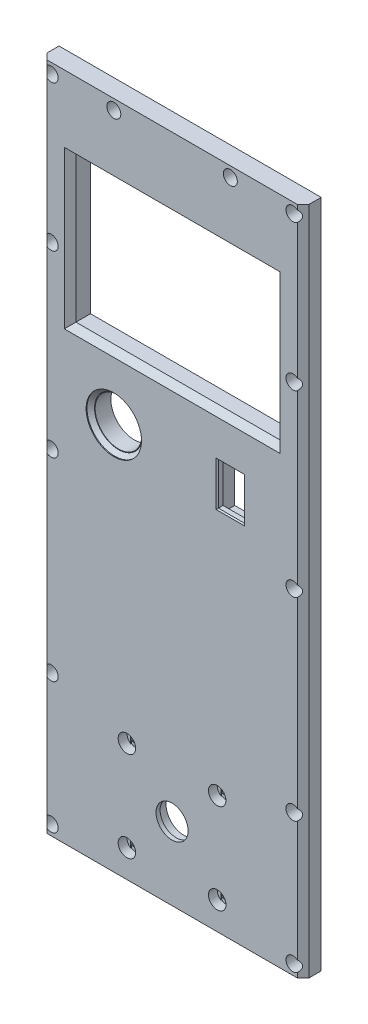
from build123d import *

# Parameters (mm, degrees)
SKETCH1_W           = 90
SKETCH1_H           = 230
SKETCH1_W_2         = 76
SKETCH1_H_2         = 216
BOSS_EXTRUDE1_DEPTH = 7
SKETCH2_W           = 76
SKETCH2_H           = 50
BOSS_EXTRUDE2_DEPTH = 7
SKETCH3_R           = 5.5
CUT_EXTRUDE1_DEPTH  = 124.689126442
SKETCH4_R           = 6.05
CUT_EXTRUDE2_DEPTH  = 5.6
SKETCH5_R           = 12
CUT_EXTRUDE3_DEPTH  = 3
SKETCH6_R           = 1.7
CUT_EXTRUDE4_DEPTH  = 124.689126442
SKETCH7_W           = 60
SKETCH7_H           = 45
CUT_EXTRUDE5_DEPTH  = 1
SKETCH8_R           = 3
CUT_EXTRUDE6_DEPTH  = 3
SKETCH9_R           = 1.45
CUT_EXTRUDE7_DEPTH  = 124.689126442
SKETCH10_R          = 2.4
CUT_EXTRUDE8_DEPTH  = 5
CHAMFER1_SIZE       = 2
SKETCH11_W          = 76
SKETCH11_H          = 21.6
BOSS_EXTRUDE3_DEPTH = 7
SKETCH12_R          = 1.45
CUT_EXTRUDE9_DEPTH  = 124.689126442
SKETCH13_R          = 2.4
CUT_EXTRUDE10_DEPTH = 5
CHAMFER2_SIZE       = 0.8
CUT_EXTRUDE11_DEPTH = 0.2
SKETCH15_W          = 2.9
SKETCH15_H          = 2.9
CUT_EXTRUDE12_DEPTH = 0.2
CUT_EXTRUDE13_DEPTH = 0.2
SKETCH17_W          = 3.4
SKETCH17_H          = 3.4
CUT_EXTRUDE14_DEPTH = 0.2
BOSS_EXTRUDE4_START = -7
SKETCH18_W          = 77.6
SKETCH18_H          = 38
BOSS_EXTRUDE4_DEPTH = 7
CHAMFER3_SIZE       = 0.8
SKETCH19_W          = 77.6
SKETCH19_H          = 108.8
BOSS_EXTRUDE5_DEPTH = 7
CUT_EXTRUDE15_DEPTH = 0.2
SKETCH21_W          = 2.9
SKETCH21_H          = 2.9
CUT_EXTRUDE16_DEPTH = 0.2
SKETCH22_W          = 70
SKETCH22_H          = 50
CUT_EXTRUDE17_DEPTH = 124.689126442
CHAMFER4_SIZE       = 2
SKETCH23_R          = 8
SKETCH23_W          = 9
SKETCH23_H          = 14.5
CUT_EXTRUDE18_DEPTH = 124.689126442
SKETCH24_W          = 11
SKETCH24_H          = 20.5
CUT_EXTRUDE19_DEPTH = 5
SKETCH25_R          = 9.5
CUT_EXTRUDE20_DEPTH = 1.6
CHAMFER5_SIZE       = 1.3
CHAMFER6_SIZE       = 0.4
SKETCH26_R          = 1.7
CUT_EXTRUDE21_DEPTH = 4


with BuildPart() as part:
    # Sketch1 → Boss-Extrude1 (new body)
    with BuildSketch(Plane.XY):
        Rectangle(SKETCH1_W, SKETCH1_H)
        Rectangle(SKETCH1_W_2, SKETCH1_H_2, mode=Mode.SUBTRACT)
    extrude(amount=BOSS_EXTRUDE1_DEPTH)

    # Sketch2 → Boss-Extrude2 (add)
    with BuildSketch(Plane.XY.offset(7)):
        with Locations((0, -83)):
            Rectangle(SKETCH2_W, SKETCH2_H)
    extrude(amount=-BOSS_EXTRUDE2_DEPTH)

    # Sketch3 → Cut-Extrude1 (cut, through all)
    with BuildSketch(Plane(origin=(0, 0, 0), x_dir=(-1, 0, 0), z_dir=(0, 0, -1))):
        with Locations((0, -90)):
            Circle(SKETCH3_R)
    extrude(amount=-CUT_EXTRUDE1_DEPTH, mode=Mode.SUBTRACT)

    # Sketch4 → Cut-Extrude2 (cut)
    with BuildSketch(Plane(origin=(0, 0, 0), x_dir=(-1, 0, 0), z_dir=(0, 0, -1))):
        with Locations((0, -90)):
            Circle(SKETCH4_R)
    extrude(amount=-CUT_EXTRUDE2_DEPTH, mode=Mode.SUBTRACT)

    # Sketch5 → Cut-Extrude3 (cut)
    with BuildSketch(Plane(origin=(0, 0, 0), x_dir=(-1, 0, 0), z_dir=(0, 0, -1))):
        with Locations((0, -90)):
            Circle(SKETCH5_R)
    extrude(amount=-CUT_EXTRUDE3_DEPTH, mode=Mode.SUBTRACT)

    # Sketch6 → Cut-Extrude4 (cut, through all)
    with BuildSketch(Plane(origin=(0, 0, 0), x_dir=(-1, 0, 0), z_dir=(0, 0, -1))):
        with Locations((-15.5, -74.5)):
            Circle(SKETCH6_R)
        with Locations((15.5, -74.5)):
            Circle(SKETCH6_R)
        with Locations((15.5, -105.5)):
            Circle(SKETCH6_R)
        with Locations((-15.5, -105.5)):
            Circle(SKETCH6_R)
    extrude(amount=-CUT_EXTRUDE4_DEPTH, mode=Mode.SUBTRACT)

    # Sketch7 → Cut-Extrude5 (cut)
    with BuildSketch(Plane(origin=(0, 0, 0), x_dir=(-1, 0, 0), z_dir=(0, 0, -1))):
        with Locations((0, -90)):
            Rectangle(SKETCH7_W, SKETCH7_H)
    extrude(amount=-CUT_EXTRUDE5_DEPTH, mode=Mode.SUBTRACT)

    # Sketch8 → Cut-Extrude6 (cut)
    with BuildSketch(Plane.XY.offset(7)):
        with Locations((-15.5, -74.5)):
            Circle(SKETCH8_R)
        with Locations((15.5, -74.5)):
            Circle(SKETCH8_R)
        with Locations((15.5, -105.5)):
            Circle(SKETCH8_R)
        with Locations((-15.5, -105.5)):
            Circle(SKETCH8_R)
    extrude(amount=-CUT_EXTRUDE6_DEPTH, mode=Mode.SUBTRACT)

    # Sketch9 → Cut-Extrude7 (cut, through all)
    with BuildSketch(Plane.XY.offset(7)):
        with Locations((-41.5, 111.5)):
            Circle(SKETCH9_R)
        with Locations((41.5, 111.5)):
            Circle(SKETCH9_R)
        with Locations((-41.5, -111.5)):
            Circle(SKETCH9_R)
        with Locations((41.5, -111.5)):
            Circle(SKETCH9_R)
        with Locations((-41.5, 61.5)):
            Circle(SKETCH9_R)
        with Locations((41.5, 61.5)):
            Circle(SKETCH9_R)
        with Locations((41.5, -66.5)):
            Circle(SKETCH9_R)
        with Locations((-41.5, -66.5)):
            Circle(SKETCH9_R)
        with Locations((-41.5, 0)):
            Circle(SKETCH9_R)
        with Locations((41.5, 0)):
            Circle(SKETCH9_R)
    extrude(amount=-CUT_EXTRUDE7_DEPTH, mode=Mode.SUBTRACT)

    # Sketch10 → Cut-Extrude8 (cut)
    with BuildSketch(Plane.XY.offset(7)):
        with Locations((-41.5, 111.5)):
            Circle(SKETCH10_R)
        with Locations((41.5, 61.5)):
            Circle(SKETCH10_R)
        with Locations((-41.5, 61.5)):
            Circle(SKETCH10_R)
        with Locations((41.5, 111.5)):
            Circle(SKETCH10_R)
        with Locations((-41.5, -111.5)):
            Circle(SKETCH10_R)
        with Locations((41.5, -111.5)):
            Circle(SKETCH10_R)
        with Locations((-41.5, -66.5)):
            Circle(SKETCH10_R)
        with Locations((41.5, -66.5)):
            Circle(SKETCH10_R)
        with Locations((-41.5, 0)):
            Circle(SKETCH10_R)
        with Locations((41.5, 0)):
            Circle(SKETCH10_R)
    extrude(amount=-CUT_EXTRUDE8_DEPTH, mode=Mode.SUBTRACT)

    # Chamfer1
    # the kernel refuses this chamfer: 2 mm, written as the material it takes off along each edge
    with BuildSketch(Plane(origin=(-45, 120.143365976, 7), x_dir=(-0.027495876610585623, 0, -0.9996219169112968), z_dir=(0, -1, 0)), Plane(origin=(45, -120.143365976, 7), x_dir=(0.027495876610585623, 0, -0.9996219169112968), z_dir=(0, 1, 0))) as chamfer1_piece_1:
        Polygon((CHAMFER1_SIZE * 0.999621916911, CHAMFER1_SIZE * 0.0274958766106), (-CHAMFER1_SIZE * 0.0274958766106, CHAMFER1_SIZE * 0.999621916911), (0, 0), align=None)
    extrude(amount=240.286731952, mode=Mode.SUBTRACT)

    # Sketch11 → Boss-Extrude3 (add)
    with BuildSketch(Plane.XY.offset(7)):
        with Locations((0, -47.2)):
            Rectangle(SKETCH11_W, SKETCH11_H)
    extrude(amount=-BOSS_EXTRUDE3_DEPTH)

    # Sketch12 → Cut-Extrude9 (cut, through all)
    with BuildSketch(Plane.XY.offset(7)):
        with Locations((-20, 111.5)):
            Circle(SKETCH12_R)
        with Locations((20, 111.5)):
            Circle(SKETCH12_R)
    extrude(amount=-CUT_EXTRUDE9_DEPTH, mode=Mode.SUBTRACT)

    # Sketch13 → Cut-Extrude10 (cut)
    with BuildSketch(Plane.XY.offset(7)):
        with Locations((-20, 111.5)):
            Circle(SKETCH13_R)
        with Locations((20, 111.5)):
            Circle(SKETCH13_R)
    extrude(amount=-CUT_EXTRUDE10_DEPTH, mode=Mode.SUBTRACT)

    # Chamfer2
    chamfer2_edges = [part.edges().sort_by_distance(p)[0] for p in [
        (0, 108, 0),
        (-38, 35.8, 0),
        (0, 108, 7),
        (-38, 35.8, 7),
        (38, 35.8, 7),
        (38, 35.8, 0),
        (0, -36.4, 7),
        (0, -36.4, 0),
        (0, -115, 0),
        (-45, 0, 0),
        (0, 115, 0),
        (45, 0, 0),
    ]]
    chamfer(chamfer2_edges, length=CHAMFER2_SIZE)

    # Sketch14 → Cut-Extrude11 (cut)
    with BuildSketch(Plane.XY.offset(2)):
        with BuildLine():
            Line((-42.95, -68.41245915), (-42.95, -64.58754085))
            ThreePointArc((-42.95, -64.58754085), (-41.5, -64.1), (-40.05, -64.58754085))
            Line((-40.05, -64.58754085), (-40.05, -68.41245915))
            ThreePointArc((-40.05, -68.41245915), (-41.5, -68.9), (-42.95, -68.41245915))
        make_face()
        with BuildLine():
            Line((-42.95, -113.41245915), (-42.95, -109.58754085))
            ThreePointArc((-42.95, -109.58754085), (-41.5, -109.1), (-40.05, -109.58754085))
            Line((-40.05, -109.58754085), (-40.05, -113.41245915))
            ThreePointArc((-40.05, -113.41245915), (-41.5, -113.9), (-42.95, -113.41245915))
        make_face()
        with BuildLine():
            Line((-42.95, 59.58754085), (-42.95, 63.41245915))
            ThreePointArc((-42.95, 63.41245915), (-41.5, 63.9), (-40.05, 63.41245915))
            Line((-40.05, 63.41245915), (-40.05, 59.58754085))
            ThreePointArc((-40.05, 59.58754085), (-41.5, 59.1), (-42.95, 59.58754085))
        make_face()
        with BuildLine():
            Line((-21.45, 109.58754085), (-21.45, 113.41245915))
            ThreePointArc((-21.45, 113.41245915), (-20, 113.9), (-18.55, 113.41245915))
            Line((-18.55, 113.41245915), (-18.55, 109.58754085))
            ThreePointArc((-18.55, 109.58754085), (-20, 109.1), (-21.45, 109.58754085))
        make_face()
        with BuildLine():
            Line((-42.95, 109.58754085), (-42.95, 113.41245915))
            ThreePointArc((-42.95, 113.41245915), (-41.5, 113.9), (-40.05, 113.41245915))
            Line((-40.05, 113.41245915), (-40.05, 109.58754085))
            ThreePointArc((-40.05, 109.58754085), (-41.5, 109.1), (-42.95, 109.58754085))
        make_face()
    cut_extrude11 = extrude(amount=-CUT_EXTRUDE11_DEPTH, mode=Mode.SUBTRACT)

    # Sketch15 → Cut-Extrude12 (cut)
    with BuildSketch(Plane.XY.offset(1.8)):
        with Locations((-41.5, -111.5)):
            Rectangle(SKETCH15_W, SKETCH15_H)
        with Locations((-41.5, -66.5)):
            Rectangle(SKETCH15_W, SKETCH15_H)
        with Locations((-41.5, 61.5)):
            Rectangle(SKETCH15_W, SKETCH15_H)
        with Locations((-41.5, 111.5)):
            Rectangle(SKETCH15_W, SKETCH15_H)
        with Locations((-20, 111.5)):
            Rectangle(SKETCH15_W, SKETCH15_H)
    cut_extrude12 = extrude(amount=-CUT_EXTRUDE12_DEPTH, mode=Mode.SUBTRACT)

    # Sketch16 → Cut-Extrude13 (cut)
    with BuildSketch(Plane.XY.offset(4)):
        with BuildLine():
            Line((-17.2, -76.971841419), (-17.2, -72.028158581))
            ThreePointArc((-17.2, -72.028158581), (-15.5, -71.5), (-13.8, -72.028158581))
            Line((-13.8, -72.028158581), (-13.8, -76.971841419))
            ThreePointArc((-13.8, -76.971841419), (-15.5, -77.5), (-17.2, -76.971841419))
        make_face()
        with BuildLine():
            Line((-17.2, -107.971841419), (-17.2, -103.028158581))
            ThreePointArc((-17.2, -103.028158581), (-15.5, -102.5), (-13.8, -103.028158581))
            Line((-13.8, -103.028158581), (-13.8, -107.971841419))
            ThreePointArc((-13.8, -107.971841419), (-15.5, -108.5), (-17.2, -107.971841419))
        make_face()
    cut_extrude13 = extrude(amount=-CUT_EXTRUDE13_DEPTH, mode=Mode.SUBTRACT)

    # Sketch17 → Cut-Extrude14 (cut)
    with BuildSketch(Plane.XY.offset(3.8)):
        with Locations((-15.5, -74.5)):
            Rectangle(SKETCH17_W, SKETCH17_H)
        with Locations((-15.5, -105.5)):
            Rectangle(SKETCH17_W, SKETCH17_H)
    cut_extrude14 = extrude(amount=-CUT_EXTRUDE14_DEPTH, mode=Mode.SUBTRACT)

    # Mirror1: Cut-Extrude11, Cut-Extrude12, Cut-Extrude13, Cut-Extrude14 across plane
    add(cut_extrude11.mirror(Plane(origin=(0, 0, 0), x_dir=(0, 0, 1), z_dir=(1, 0, 0))), mode=Mode.SUBTRACT)
    add(cut_extrude12.mirror(Plane(origin=(0, 0, 0), x_dir=(0, 0, 1), z_dir=(1, 0, 0))), mode=Mode.SUBTRACT)
    add(cut_extrude13.mirror(Plane(origin=(0, 0, 0), x_dir=(0, 0, 1), z_dir=(1, 0, 0))), mode=Mode.SUBTRACT)
    add(cut_extrude14.mirror(Plane(origin=(0, 0, 0), x_dir=(0, 0, 1), z_dir=(1, 0, 0))), mode=Mode.SUBTRACT)

    # Sketch18 → Boss-Extrude4 (add)
    with BuildSketch(Plane.XY.offset(7).offset(BOSS_EXTRUDE4_START)):
        with Locations((0, 89.8)):
            Rectangle(SKETCH18_W, SKETCH18_H)
    extrude(amount=BOSS_EXTRUDE4_DEPTH)

    # Chamfer3
    chamfer3_edges = [part.edges().sort_by_distance(p)[0] for p in [
        (0, 70.8, 7),
    ]]
    chamfer(chamfer3_edges, length=CHAMFER3_SIZE)

    # Sketch19 → Boss-Extrude5 (add)
    with BuildSketch(Plane.XY.offset(7)):
        with Locations((0, 17.2)):
            Rectangle(SKETCH19_W, SKETCH19_H)
    extrude(amount=-BOSS_EXTRUDE5_DEPTH)

    # Sketch20 → Cut-Extrude15 (cut)
    with BuildSketch(Plane.XY.offset(2)):
        with BuildLine():
            Line((-42.95, -1.91245915), (-42.95, 1.91245915))
            ThreePointArc((-42.95, 1.91245915), (-41.5, 2.4), (-40.05, 1.91245915))
            Line((-40.05, 1.91245915), (-40.05, -1.91245915))
            ThreePointArc((-40.05, -1.91245915), (-41.5, -2.4), (-42.95, -1.91245915))
        make_face()
    cut_extrude15 = extrude(amount=-CUT_EXTRUDE15_DEPTH, mode=Mode.SUBTRACT)

    # Sketch21 → Cut-Extrude16 (cut)
    with BuildSketch(Plane.XY.offset(1.8)):
        with Locations((-41.5, 0)):
            Rectangle(SKETCH21_W, SKETCH21_H)
    cut_extrude16 = extrude(amount=-CUT_EXTRUDE16_DEPTH, mode=Mode.SUBTRACT)

    # Mirror2: Cut-Extrude15, Cut-Extrude16 across plane
    add(cut_extrude15.mirror(Plane(origin=(0, 0, 0), x_dir=(0, 0, 1), z_dir=(1, 0, 0))), mode=Mode.SUBTRACT)
    add(cut_extrude16.mirror(Plane(origin=(0, 0, 0), x_dir=(0, 0, 1), z_dir=(1, 0, 0))), mode=Mode.SUBTRACT)

    # Sketch22 → Cut-Extrude17 (cut, through all)
    with BuildSketch(Plane.XY.offset(7)):
        with Locations((0, 65)):
            Rectangle(SKETCH22_W, SKETCH22_H)
    extrude(amount=-CUT_EXTRUDE17_DEPTH, mode=Mode.SUBTRACT)

    # Chamfer4
    chamfer4_edges = [part.edges().sort_by_distance(p)[0] for p in [
        (35, 65, 7),
        (0, 90, 7),
        (-35, 65, 7),
        (0, 40, 7),
    ]]
    chamfer(chamfer4_edges, length=CHAMFER4_SIZE)

    # Sketch23 → Cut-Extrude18 (cut, through all)
    with BuildSketch(Plane.XY.offset(7)):
        with Locations((-20, 18)):
            Circle(SKETCH23_R)
        with Locations((20, 18)):
            Rectangle(SKETCH23_W, SKETCH23_H)
    extrude(amount=-CUT_EXTRUDE18_DEPTH, mode=Mode.SUBTRACT)

    # Sketch24 → Cut-Extrude19 (cut)
    with BuildSketch(Plane(origin=(0, 0, 0), x_dir=(-1, 0, 0), z_dir=(0, 0, -1))):
        with Locations((-20, 18)):
            Rectangle(SKETCH24_W, SKETCH24_H)
    extrude(amount=-CUT_EXTRUDE19_DEPTH, mode=Mode.SUBTRACT)

    # Sketch25 → Cut-Extrude20 (cut)
    with BuildSketch(Plane.XY.offset(7)):
        with Locations((-20, 18)):
            Circle(SKETCH25_R)
    extrude(amount=-CUT_EXTRUDE20_DEPTH, mode=Mode.SUBTRACT)

    # Chamfer5
    chamfer5_edges = [part.edges().sort_by_distance(p)[0] for p in [
        (-29.5, 18, 5.4),
    ]]
    chamfer(chamfer5_edges, length=CHAMFER5_SIZE)

    # Chamfer6
    chamfer6_edges = [part.edges().sort_by_distance(p)[0] for p in [
        (24.5, 18, 7),
        (20, 25.25, 7),
        (15.5, 18, 7),
        (20, 10.75, 7),
    ]]
    chamfer(chamfer6_edges, length=CHAMFER6_SIZE)

    # Sketch26 → Cut-Extrude21 (cut)
    with BuildSketch(Plane(origin=(0, 0, 0), x_dir=(-1, 0, 0), z_dir=(0, 0, -1))):
        with Locations((0, -5)):
            Circle(SKETCH26_R)
        with Locations((10, -5)):
            Circle(SKETCH26_R)
        with Locations((20, -5)):
            Circle(SKETCH26_R)
        with Locations((30, -5)):
            Circle(SKETCH26_R)
        with Locations((10, -15)):
            Circle(SKETCH26_R)
        with Locations((20, -15)):
            Circle(SKETCH26_R)
        with Locations((30, -15)):
            Circle(SKETCH26_R)
        with Locations((10, -25)):
            Circle(SKETCH26_R)
        with Locations((20, -25)):
            Circle(SKETCH26_R)
        with Locations((30, -25)):
            Circle(SKETCH26_R)
        with Locations((10, -35)):
            Circle(SKETCH26_R)
        with Locations((20, -35)):
            Circle(SKETCH26_R)
        with Locations((30, -35)):
            Circle(SKETCH26_R)
        with Locations((10, -45)):
            Circle(SKETCH26_R)
        with Locations((20, -45)):
            Circle(SKETCH26_R)
        with Locations((30, -45)):
            Circle(SKETCH26_R)
        with Locations((0, -15)):
            Circle(SKETCH26_R)
        with Locations((0, -25)):
            Circle(SKETCH26_R)
        with Locations((0, -35)):
            Circle(SKETCH26_R)
        with Locations((0, -45)):
            Circle(SKETCH26_R)
    cut_extrude21 = extrude(amount=-CUT_EXTRUDE21_DEPTH, mode=Mode.SUBTRACT)

    # Mirror3: Cut-Extrude21 across plane
    add(cut_extrude21.mirror(Plane(origin=(0, 0, 0), x_dir=(0, 0, 1), z_dir=(1, 0, 0))), mode=Mode.SUBTRACT)


solid = part.part
